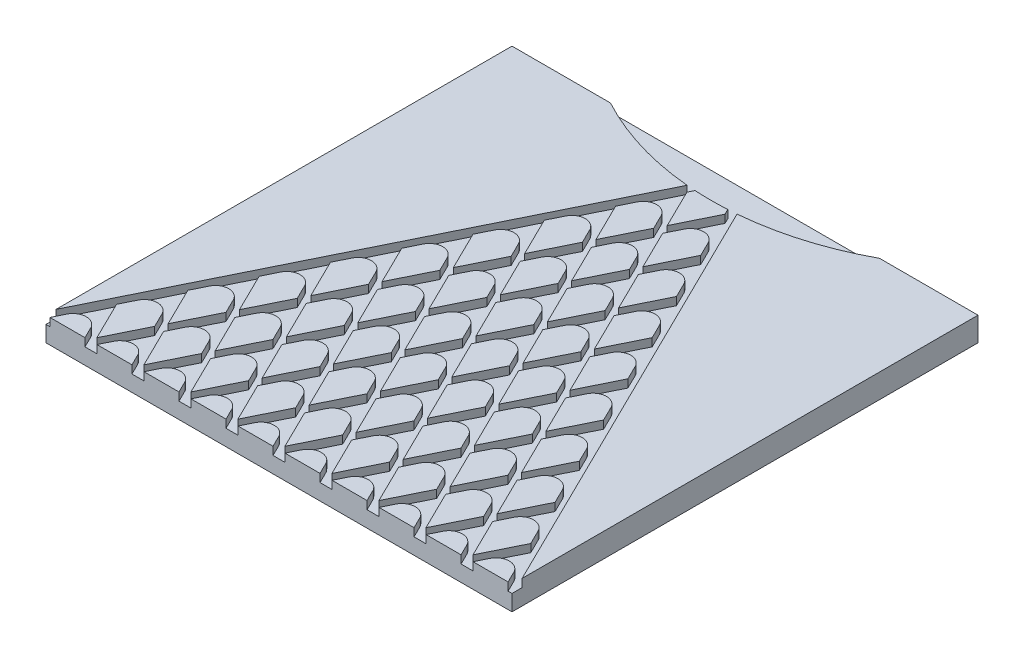
from build123d import *

# Parameters (mm, degrees)
ESQUISSE1_W                     = 350
ESQUISSE1_H                     = 350
BOSS_EXTRU_1_DEPTH              = 18
ENL_V_START                     = -6
ENL_V_DE_MAT_EXTRU_MINCE2_DEPTH = 6
CONG_1_R                        = 10
BACHAUT_DEPTH                   = 6


# Read off the part's stored shape, not the designer's step: Enlèv. de mat.-Extru.-Mince2
with BuildPart() as part:
    # Esquisse1 → Boss.-Extru.1 (new body)
    with BuildSketch(Plane(origin=(0, 0, 0), x_dir=(1, 0, 0), z_dir=(0, 1, 0))):
        Rectangle(ESQUISSE1_W, ESQUISSE1_H)
    extrude(amount=BOSS_EXTRU_1_DEPTH)

    # Enlèv. de mat.-Extru.-Mince2 outline → Enlèv. de mat.-Extru.-Mince2 (cut)
    with BuildSketch(Plane(origin=(0, 18, 0), x_dir=(1, 0, 0), z_dir=(0, 1, 0)).offset(ENL_V_START)):
        Polygon((-172.04540984, -175), (-158.892403305, -148.259175343), (-145.739396769, -175), (-136.735986884, -175), (-123.582980348, -148.259175343), (-110.429973813, -175), (-101.426563927, -175), (-88.273557392, -148.259175343), (-75.120550856, -175), (-66.117140971, -175), (-52.964134435, -148.259175343), (-39.811127899, -175), (-30.807718014, -175), (-17.654711478, -148.259175343), (-4.501704943, -175), (4.501704943, -175), (17.654711478, -148.259175343), (30.807718014, -175), (39.811127899, -175), (52.964134435, -148.259175343), (66.117140971, -175), (75.120550856, -175), (88.273557392, -148.259175343), (101.426563927, -175), (110.429973813, -175), (123.582980348, -148.259175343), (136.735986884, -175), (145.739396769, -175), (158.892403305, -148.259175343), (172.04540984, -175), (175, -175), (175, -167.412748137), (6.57747856, 175), (-6.57747856, 175), (-175, -167.412748137), (-175, -175), align=None)
        Polygon((-155.549137848, -141.462122888), (-141.237691827, -112.366123611), (-126.926245805, -141.462122888), (-141.237691827, -170.558122164), align=None, mode=Mode.SUBTRACT)
        Polygon((-120.239714891, -141.462122888), (-105.92826887, -112.366123611), (-91.616822849, -141.462122888), (-105.92826887, -170.558122164), align=None, mode=Mode.SUBTRACT)
        Polygon((-137.89442637, -105.569071156), (-123.582980348, -76.47307188), (-109.271534327, -105.569071156), (-123.582980348, -134.665070433), align=None, mode=Mode.SUBTRACT)
        Polygon((-102.585003413, -105.569071156), (-88.273557392, -76.47307188), (-73.96211137, -105.569071156), (-88.273557392, -134.665070433), align=None, mode=Mode.SUBTRACT)
        Polygon((-84.930291935, -141.462122888), (-70.618845913, -112.366123611), (-56.307399892, -141.462122888), (-70.618845913, -170.558122164), align=None, mode=Mode.SUBTRACT)
        Polygon((-49.620868978, -141.462122888), (-35.309422957, -112.366123611), (-20.997976935, -141.462122888), (-35.309422957, -170.558122164), align=None, mode=Mode.SUBTRACT)
        Polygon((-67.275580456, -105.569071156), (-52.964134435, -76.47307188), (-38.652688414, -105.569071156), (-52.964134435, -134.665070433), align=None, mode=Mode.SUBTRACT)
        Polygon((-31.9661575, -105.569071156), (-17.654711478, -76.47307188), (-3.343265457, -105.569071156), (-17.654711478, -134.665070433), align=None, mode=Mode.SUBTRACT)
        Polygon((-120.239714891, -69.676019424), (-105.92826887, -40.580020148), (-91.616822849, -69.676019424), (-105.92826887, -98.772018701), align=None, mode=Mode.SUBTRACT)
        Polygon((-102.585003413, -33.782967693), (-88.273557392, -4.686968416), (-73.96211137, -33.782967693), (-88.273557392, -62.878966969), align=None, mode=Mode.SUBTRACT)
        Polygon((-84.930291935, -69.676019424), (-70.618845913, -40.580020148), (-56.307399892, -69.676019424), (-70.618845913, -98.772018701), align=None, mode=Mode.SUBTRACT)
        Polygon((-49.620868978, -69.676019424), (-35.309422957, -40.580020148), (-20.997976935, -69.676019424), (-35.309422957, -98.772018701), align=None, mode=Mode.SUBTRACT)
        Polygon((-67.275580456, -33.782967693), (-52.964134435, -4.686968416), (-38.652688414, -33.782967693), (-52.964134435, -62.878966969), align=None, mode=Mode.SUBTRACT)
        Polygon((-31.9661575, -33.782967693), (-17.654711478, -4.686968416), (-3.343265457, -33.782967693), (-17.654711478, -62.878966969), align=None, mode=Mode.SUBTRACT)
        Polygon((-14.311446021, -141.462122888), (0, -112.366123611), (14.311446021, -141.462122888), (0, -170.558122164), align=None, mode=Mode.SUBTRACT)
        Polygon((35.309422957, -112.366123611), (49.620868978, -141.462122888), (35.309422957, -170.558122164), (20.997976935, -141.462122888), align=None, mode=Mode.SUBTRACT)
        Polygon((56.307399892, -141.462122888), (70.618845913, -112.366123611), (84.930291935, -141.462122888), (70.618845913, -170.558122164), align=None, mode=Mode.SUBTRACT)
        Polygon((17.654711478, -76.47307188), (31.9661575, -105.569071156), (17.654711478, -134.665070433), (3.343265457, -105.569071156), align=None, mode=Mode.SUBTRACT)
        Polygon((38.652688414, -105.569071156), (52.964134435, -76.47307188), (67.275580456, -105.569071156), (52.964134435, -134.665070433), align=None, mode=Mode.SUBTRACT)
        Polygon((105.92826887, -112.366123611), (120.239714891, -141.462122888), (105.92826887, -170.558122164), (91.616822849, -141.462122888), align=None, mode=Mode.SUBTRACT)
        Polygon((126.926245805, -141.462122888), (141.237691827, -112.366123611), (155.549137848, -141.462122888), (141.237691827, -170.558122164), align=None, mode=Mode.SUBTRACT)
        Polygon((88.273557392, -76.47307188), (102.585003413, -105.569071156), (88.273557392, -134.665070433), (73.96211137, -105.569071156), align=None, mode=Mode.SUBTRACT)
        Polygon((109.271534327, -105.569071156), (123.582980348, -76.47307188), (137.89442637, -105.569071156), (123.582980348, -134.665070433), align=None, mode=Mode.SUBTRACT)
        Polygon((-14.311446021, -69.676019424), (0, -40.580020148), (14.311446021, -69.676019424), (0, -98.772018701), align=None, mode=Mode.SUBTRACT)
        Polygon((20.997976935, -69.676019424), (35.309422957, -40.580020148), (49.620868978, -69.676019424), (35.309422957, -98.772018701), align=None, mode=Mode.SUBTRACT)
        Polygon((70.618845913, -40.580020148), (84.930291935, -69.676019424), (70.618845913, -98.772018701), (56.307399892, -69.676019424), align=None, mode=Mode.SUBTRACT)
        Polygon((3.343265457, -33.782967693), (17.654711478, -4.686968416), (31.9661575, -33.782967693), (17.654711478, -62.878966969), align=None, mode=Mode.SUBTRACT)
        Polygon((38.652688414, -33.782967693), (52.964134435, -4.686968416), (67.275580456, -33.782967693), (52.964134435, -62.878966969), align=None, mode=Mode.SUBTRACT)
        Polygon((91.616822849, -69.676019424), (105.92826887, -40.580020148), (120.239714891, -69.676019424), (105.92826887, -98.772018701), align=None, mode=Mode.SUBTRACT)
        Polygon((73.96211137, -33.782967693), (88.273557392, -4.686968416), (102.585003413, -33.782967693), (88.273557392, -62.878966969), align=None, mode=Mode.SUBTRACT)
        Polygon((-84.930291935, 2.110084039), (-70.618845913, 31.206083316), (-56.307399892, 2.110084039), (-70.618845913, -26.985915237), align=None, mode=Mode.SUBTRACT)
        Polygon((-67.275580456, 38.003135771), (-52.964134435, 67.099135047), (-38.652688414, 38.003135771), (-52.964134435, 8.907136494), align=None, mode=Mode.SUBTRACT)
        Polygon((-49.620868978, 2.110084039), (-35.309422957, 31.206083316), (-20.997976935, 2.110084039), (-35.309422957, -26.985915237), align=None, mode=Mode.SUBTRACT)
        Polygon((-31.9661575, 38.003135771), (-17.654711478, 67.099135047), (-3.343265457, 38.003135771), (-17.654711478, 8.907136494), align=None, mode=Mode.SUBTRACT)
        Polygon((-49.620868978, 73.896187503), (-35.309422957, 102.992186779), (-20.997976935, 73.896187503), (-35.309422957, 44.800188226), align=None, mode=Mode.SUBTRACT)
        Polygon((-31.9661575, 109.789239234), (-17.654711478, 138.885238511), (-3.343265457, 109.789239234), (-17.654711478, 80.693239958), align=None, mode=Mode.SUBTRACT)
        Polygon((-14.311446021, 2.110084039), (0, 31.206083316), (14.311446021, 2.110084039), (0, -26.985915237), align=None, mode=Mode.SUBTRACT)
        Polygon((20.997976935, 2.110084039), (35.309422957, 31.206083316), (49.620868978, 2.110084039), (35.309422957, -26.985915237), align=None, mode=Mode.SUBTRACT)
        Polygon((3.343265457, 38.003135771), (17.654711478, 67.099135047), (31.9661575, 38.003135771), (17.654711478, 8.907136494), align=None, mode=Mode.SUBTRACT)
        Polygon((56.307399892, 2.110084039), (70.618845913, 31.206083316), (84.930291935, 2.110084039), (70.618845913, -26.985915237), align=None, mode=Mode.SUBTRACT)
        Polygon((38.652688414, 38.003135771), (52.964134435, 67.099135047), (67.275580456, 38.003135771), (52.964134435, 8.907136494), align=None, mode=Mode.SUBTRACT)
        Polygon((0, 102.992186779), (14.311446021, 73.896187503), (0, 44.800188226), (-14.311446021, 73.896187503), align=None, mode=Mode.SUBTRACT)
        Polygon((20.997976935, 73.896187503), (35.309422957, 102.992186779), (49.620868978, 73.896187503), (35.309422957, 44.800188226), align=None, mode=Mode.SUBTRACT)
        Polygon((3.343265457, 109.789239234), (17.654711478, 138.885238511), (31.9661575, 109.789239234), (17.654711478, 80.693239958), align=None, mode=Mode.SUBTRACT)
        Polygon((-14.311446021, 145.682290966), (0, 174.778290243), (14.311446021, 145.682290966), (0, 116.58629169), align=None, mode=Mode.SUBTRACT)
    extrude(amount=ENL_V_DE_MAT_EXTRU_MINCE2_DEPTH, mode=Mode.SUBTRACT)

    # Congé1
    cong_1_edges = [part.edges().sort_by_distance(p)[0] for p in [
        (-158.892403305, 15, 148.259175343),
        (158.892403305, 15, 148.259175343),
        (123.582980348, 15, 148.259175343),
        (88.273557392, 15, 148.259175343),
        (52.964134435, 15, 148.259175343),
        (17.654711478, 15, 148.259175343),
        (-17.654711478, 15, 148.259175343),
        (-52.964134435, 15, 148.259175343),
        (-88.273557392, 15, 148.259175343),
        (-123.582980348, 15, 148.259175343),
        (141.237691827, 15, 112.366123611),
        (70.618845913, 15, 40.580020148),
        (123.582980348, 15, 76.47307188),
        (52.964134435, 15, 4.686968416),
        (35.309422957, 15, -31.206083316),
        (17.654711478, 15, 4.686968416),
        (88.273557392, 15, 76.47307188),
        (105.92826887, 15, 112.366123611),
        (105.92826887, 15, 40.580020148),
        (35.309422957, 15, 40.580020148),
        (88.273557392, 15, 4.686968416),
        (70.618845913, 15, -31.206083316),
        (17.654711478, 15, -67.099135047),
        (0, 15, -31.206083316),
        (52.964134435, 15, 76.47307188),
        (70.618845913, 15, 112.366123611),
        (52.964134435, 15, -67.099135047),
        (-17.654711478, 15, 4.686968416),
        (0, 15, 40.580020148),
        (17.654711478, 15, 76.47307188),
        (0, 15, -102.992186779),
        (35.309422957, 15, 112.366123611),
        (-35.309422957, 15, 40.580020148),
        (35.309422957, 15, -102.992186779),
        (-17.654711478, 15, -67.099135047),
        (-17.654711478, 15, 76.47307188),
        (17.654711478, 15, -138.885238511),
        (-35.309422957, 15, -31.206083316),
        (0, 15, 112.366123611),
        (0, 15, -174.778290243),
        (-17.654711478, 15, -138.885238511),
        (-52.964134435, 15, 4.686968416),
        (-52.964134435, 15, 76.47307188),
        (-35.309422957, 15, -102.992186779),
        (-35.309422957, 15, 112.366123611),
        (-52.964134435, 15, -67.099135047),
        (-70.618845913, 15, 40.580020148),
        (-70.618845913, 15, -31.206083316),
        (-88.273557392, 15, 76.47307188),
        (-70.618845913, 15, 112.366123611),
        (-88.273557392, 15, 4.686968416),
        (-105.92826887, 15, 112.366123611),
        (-105.92826887, 15, 40.580020148),
        (-123.582980348, 15, 76.47307188),
        (-141.237691827, 15, 112.366123611),
    ]]
    fillet(cong_1_edges, radius=CONG_1_R)

    # Esquisse3 → BacHaut (cut)
    with BuildSketch(Plane(origin=(0, 18, 0), x_dir=(1, 0, 0), z_dir=(0, 1, 0))):
        with BuildLine():
            Line((-112.500195806, 181.663433486), (101.04956725, 175))
            ThreePointArc((101.04956725, 175), (-6.624164856, 149.525347125), (-112.500195806, 181.663433486))
        make_face()
    extrude(amount=-BACHAUT_DEPTH, mode=Mode.SUBTRACT)


solid = part.part
